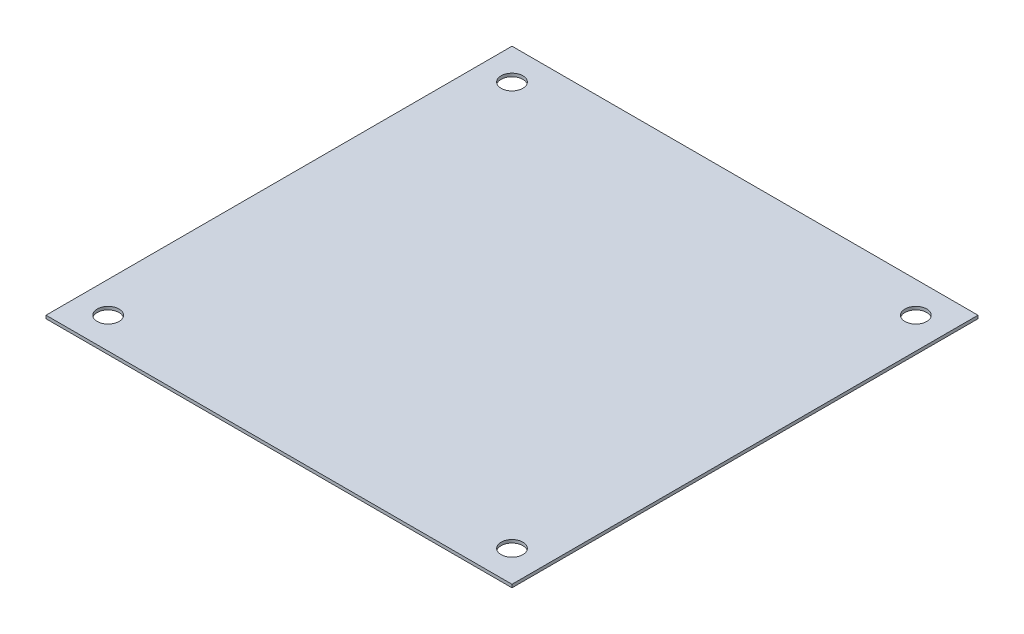
from build123d import *

# Parameters (mm, degrees)
SKETCH1_W          = 150
SKETCH1_H          = 150
BASE_FLANGE1_DEPTH = 1
SKETCH6_R          = 3.5
CUT_EXTRUDE1_DEPTH = 1


# Sheet-metal steps are written as plain solids
with BuildPart() as part:
    # Sketch1 → Base-Flange1 (new body)
    with BuildSketch(Plane(origin=(0, 0, 0), x_dir=(1, 0, 0), z_dir=(0, 1, 0))):
        Rectangle(SKETCH1_W, SKETCH1_H)
    extrude(amount=BASE_FLANGE1_DEPTH)

    # Sketch6 → Cut-Extrude1 (cut)
    with BuildSketch(Plane(origin=(0, 1, 0), x_dir=(1, 0, 0), z_dir=(0, 1, 0))):
        with Locations(Location((-65, -65, 0), (0, 0, 270))):
            Circle(SKETCH6_R)
        with Locations(Location((-65, 65, 0), (0, 0, 270))):
            Circle(SKETCH6_R)
        with Locations(Location((65, 65, 0), (0, 0, 270))):
            Circle(SKETCH6_R)
        with Locations(Location((65, -65, 0), (0, 0, 270))):
            Circle(SKETCH6_R)
    extrude(amount=-CUT_EXTRUDE1_DEPTH, mode=Mode.SUBTRACT)


solid = part.part
